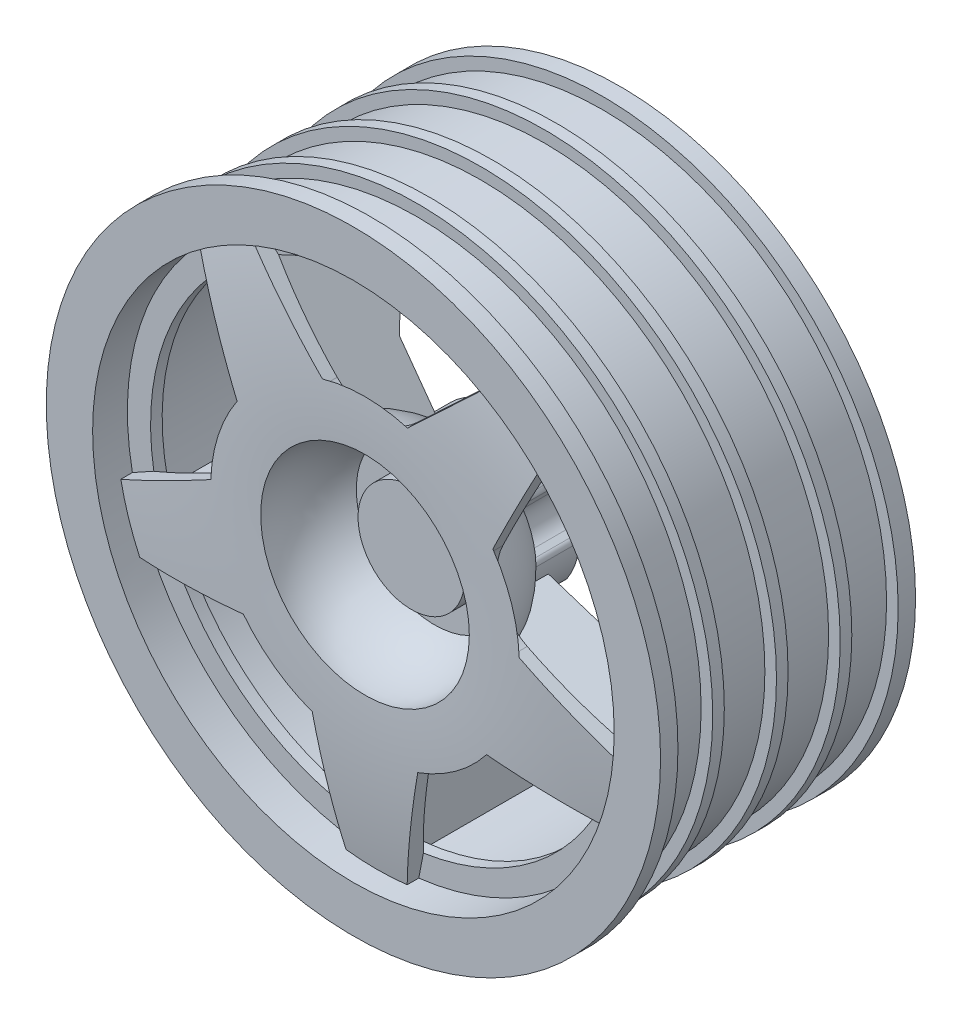
from build123d import *
from build123d.topology import SkipClean

# Parameters (mm, degrees)
CUT_EXTRUDE2_DEPTH  = 2
BOSS_EXTRUDE1_DEPTH = 4
BOSS_EXTRUDE2_START = 14
SKETCH4_R           = 4.6
BOSS_EXTRUDE2_DEPTH = 14
SKETCH6_R           = 2.55
CUT_EXTRUDE3_DEPTH  = 4
CUT_EXTRUDE4_DEPTH  = 10
BOSS_EXTRUDE4_DEPTH = 0.5
CIRPATTERN1_COUNT   = 5


with BuildPart() as part:
    # Sketch1 → Revolve1 (revolve)
    with BuildSketch(Plane(origin=(0, 0, 0), x_dir=(0, 0, -1), z_dir=(1, 0, 0))):
        with BuildLine():
            Line((0, 0), (0, 4.6))
            Line((0, 4.6), (2, 4.6))
            Line((2, 4.6), (2, 6.75))
            ThreePointArc((2, 6.75), (-0.741094961, 8.565413436), (-4, 9))
            ThreePointArc((-4, 9), (-3.866205479, 15.777126332), (-3, 22.5))
            Line((-3, 22.5), (-5, 22.5))
            Line((-5, 22.5), (-5, 26.5))
            Line((-5, 26.5), (-3.5, 26.5))
            Line((-3.5, 26.5), (-3.5, 24.5))
            Line((-3.5, 24.5), (0.5, 24.5))
            Line((0.5, 24.5), (0.5, 25.5))
            Line((0.5, 25.5), (1.5, 25.5))
            Line((1.5, 25.5), (1.5, 24.5))
            Line((1.5, 24.5), (6, 24.5))
            Line((6, 24.5), (6, 25.5))
            Line((6, 25.5), (7, 25.5))
            Line((7, 25.5), (7, 24.5))
            Line((7, 24.5), (11.5, 24.5))
            Line((11.5, 24.5), (11.5, 25.5))
            Line((11.5, 25.5), (12.5, 25.5))
            Line((12.5, 25.5), (12.5, 24.5))
            Line((12.5, 24.5), (16.5, 24.5))
            Line((16.5, 24.5), (16.5, 25.5))
            Line((16.5, 25.5), (18, 25.5))
            Line((18, 25.5), (18, 22.5))
            Line((18, 22.5), (-1, 22.5))
            Line((-1, 22.5), (-1, 20.5))
            Line((-1, 20.5), (-2, 20.5))
            ThreePointArc((-2, 20.5), (-2.838693907, 15.282256563), (-3, 10))
            ThreePointArc((-3, 10), (0.798176613, 9.017226552), (4, 6.75))
            Line((4, 6.75), (4, 0))
            Line((4, 0), (0, 0))
        make_face()
    revolve(axis=Axis((0, 0, 16.812624936), (0, 0, -1)))

    # Sketch2 → Cut-Extrude2 (cut)
    with SkipClean():  # the faces are left unmerged after this step: merging them gives an invalid solid
        with BuildSketch(Plane.XY.offset(4)):
            with BuildLine():
                ThreePointArc((-3.4099918, 12.549989276), (0, 11.206757784), (3.4099918, 12.549989276))
                Line((3.4099918, 12.549989276), (11, 19.627786426))
                ThreePointArc((11, 19.627786426), (0, 22.5), (-11, 19.627786426))
                Line((-11, 19.627786426), (-3.4099918, 12.549989276))
            make_face()
            with BuildLine():
                ThreePointArc((22.066321119, -4.396302112), (21.398771617, 6.952882373), (15.267947243, 16.526941247))
                Line((15.267947243, 16.526941247), (10.882003664, 7.121254888))
                ThreePointArc((10.882003664, 7.121254888), (10.658260017, 3.463078607), (12.989494498, 0.635065043))
                Line((12.989494498, 0.635065043), (22.066321119, -4.396302112))
            make_face()
            with BuildLine():
                ThreePointArc((2.637736458, -22.344850556), (13.225168177, -18.202882373), (20.436110335, -9.413575006))
                Line((20.436110335, -9.413575006), (10.13543993, -8.148811713))
                ThreePointArc((10.13543993, -8.148811713), (6.587166952, -9.066457499), (4.617957296, -12.157497494))
                Line((4.617957296, -12.157497494), (2.637736458, -22.344850556))
            make_face()
            with BuildLine():
                ThreePointArc((-20.436110335, -9.413575006), (-13.225168177, -18.202882373), (-2.637736458, -22.344850556))
                Line((-2.637736458, -22.344850556), (-4.617957296, -12.157497494))
                ThreePointArc((-4.617957296, -12.157497494), (-6.587166952, -9.066457499), (-10.13543993, -8.148811713))
                Line((-10.13543993, -8.148811713), (-20.436110335, -9.413575006))
            make_face()
            with BuildLine():
                ThreePointArc((-15.267947243, 16.526941247), (-21.398771617, 6.952882373), (-22.066321119, -4.396302112))
                Line((-22.066321119, -4.396302112), (-12.989494498, 0.635065043))
                ThreePointArc((-12.989494498, 0.635065043), (-10.658260017, 3.463078607), (-10.882003664, 7.121254888))
                Line((-10.882003664, 7.121254888), (-15.267947243, 16.526941247))
            make_face()
        extrude(amount=-CUT_EXTRUDE2_DEPTH, mode=Mode.SUBTRACT)
    add(part.part.scale(1), mode=Mode.REPLACE)  # the faces are merged on a copy

    # Sketch3 → Boss-Extrude1 (add)
    with BuildSketch(Plane(origin=(0, 0, -4), x_dir=(-1, 0, 0), z_dir=(0, 0, -1))):
        with BuildLine():
            Line((-1.36399672, 5.591575785), (-1.779068311, 5.978636305))
            ThreePointArc((-1.779068311, 5.978636305), (-2.02334422, 6.103514863), (-2.296739782, 6.080706075))
            ThreePointArc((-2.296739782, 6.080706075), (-3.82060414, 5.258610463), (-5.073363513, 4.063370851))
            ThreePointArc((-5.073363513, 4.063370851), (-5.179539833, 3.810404523), (-5.136258674, 3.539494731))
            Line((-5.136258674, 3.539494731), (-4.89640642, 3.025129912))
            ThreePointArc((-4.89640642, 3.025129912), (-4.806908961, 1.5618594), (-5.739402754, 0.430653974))
            Line((-5.739402754, 0.430653974), (-6.235783359, 0.155505712))
            ThreePointArc((-6.235783359, 0.155505712), (-6.430035332, -0.038224887), (-6.492826761, -0.30528782))
            ThreePointArc((-6.492826761, -0.30528782), (-6.181867356, -2.008610463), (-5.43225087, -3.569404781))
            ThreePointArc((-5.43225087, -3.569404781), (-5.224475883, -3.748555357), (-4.953450746, -3.791108258))
            Line((-4.953450746, -3.791108258), (-4.39014231, -3.721942679))
            ThreePointArc((-4.39014231, -3.721942679), (-2.970833119, -4.089000994), (-2.183149257, -5.325416992))
            Line((-2.183149257, -5.325416992), (-2.074857751, -5.88252849))
            ThreePointArc((-2.074857751, -5.88252849), (-1.950636164, -6.127139142), (-1.71604784, -6.269384325))
            ThreePointArc((-1.71604784, -6.269384325), (0, -6.5), (1.71604784, -6.269384325))
            ThreePointArc((1.71604784, -6.269384325), (1.950636164, -6.127139142), (2.074857751, -5.88252849))
            Line((2.074857751, -5.88252849), (2.183149257, -5.325416992))
            ThreePointArc((2.183149257, -5.325416992), (2.970833119, -4.089000994), (4.39014231, -3.721942679))
            Line((4.39014231, -3.721942679), (4.953450746, -3.791108258))
            ThreePointArc((4.953450746, -3.791108258), (5.224475883, -3.748555357), (5.43225087, -3.569404781))
            ThreePointArc((5.43225087, -3.569404781), (6.181867356, -2.008610463), (6.492826761, -0.30528782))
            ThreePointArc((6.492826761, -0.30528782), (6.430035332, -0.038224887), (6.235783359, 0.155505712))
            Line((6.235783359, 0.155505712), (5.739402754, 0.430653974))
            ThreePointArc((5.739402754, 0.430653974), (4.806908961, 1.5618594), (4.89640642, 3.025129912))
            Line((4.89640642, 3.025129912), (5.136258674, 3.539494731))
            ThreePointArc((5.136258674, 3.539494731), (5.179539833, 3.810404523), (5.073363513, 4.063370851))
            ThreePointArc((5.073363513, 4.063370851), (3.82060414, 5.258610463), (2.296739782, 6.080706075))
            ThreePointArc((2.296739782, 6.080706075), (2.02334422, 6.103514863), (1.779068311, 5.978636305))
            Line((1.779068311, 5.978636305), (1.36399672, 5.591575785))
            ThreePointArc((1.36399672, 5.591575785), (0, 5.054283188), (-1.36399672, 5.591575785))
        make_face()
    extrude(amount=BOSS_EXTRUDE1_DEPTH)

    # Sketch4 → Boss-Extrude2 (add)
    with BuildSketch(Plane(origin=(0, 0, -8), x_dir=(-1, 0, 0), z_dir=(0, 0, -1)).offset(BOSS_EXTRUDE2_START)):
        Circle(SKETCH4_R)
    extrude(amount=-BOSS_EXTRUDE2_DEPTH)

    # Sketch6 → Cut-Extrude3 (cut)
    with BuildSketch(Plane(origin=(0, 0, -22), x_dir=(-1, 0, 0), z_dir=(0, 0, -1))):
        Circle(SKETCH6_R)
    extrude(amount=-CUT_EXTRUDE3_DEPTH, mode=Mode.SUBTRACT)

    # Sketch7 → Cut-Extrude4 (cut)
    with BuildSketch(Plane(origin=(0, 0, -18), x_dir=(-1, 0, 0), z_dir=(0, 0, -1))):
        with BuildLine():
            Line((-2, 1.581929202), (-2, -1.581929202))
            ThreePointArc((-2, -1.581929202), (0, -2.55), (2, -1.581929202))
            Line((2, -1.581929202), (2, 1.581929202))
            ThreePointArc((2, 1.581929202), (0, 2.55), (-2, 1.581929202))
        make_face()
    extrude(amount=-CUT_EXTRUDE4_DEPTH, mode=Mode.SUBTRACT)

    # Sketch8 → Boss-Extrude4 (add, symmetric)
    with SkipClean():  # the faces are left unmerged after this step: merging them gives an invalid solid
        with BuildSketch(Plane(origin=(0, 0, 0), x_dir=(0, 0, -1), z_dir=(1, 0, 0))):
            Polygon((-1, -22.759565799), (10, -22.759565799), (10, -19.255695256), (5.5, -11.769384325), (5.5, -6.269384325), (3.792277865, -6.269384325), (0.641833701, -8.818845165), (-3.280401172, -9.793357963), (-3.034158557, -16.790058033), (-2.192142737, -20.803485631), (-1, -20.803485631), align=None)
        boss_extrude4 = extrude(amount=BOSS_EXTRUDE4_DEPTH, both=True)
    add(part.part.scale(1), mode=Mode.REPLACE)  # the faces are merged on a copy

    # CirPattern1: Boss-Extrude4 ×5 about axis
    cirpattern1_axis = Axis((0, 0, 16.812624936), (0, 0, 1))
    for i in range(1, CIRPATTERN1_COUNT):
        add(boss_extrude4.rotate(cirpattern1_axis, i * 360 / CIRPATTERN1_COUNT))


solid = part.part
